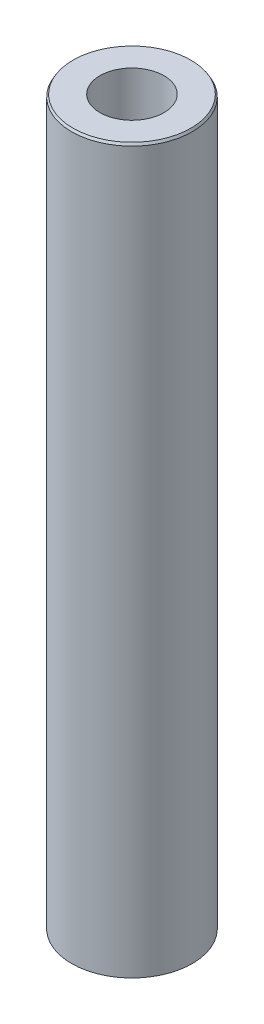
from build123d import *
from OCP.BRepFilletAPI import BRepFilletAPI_MakeChamfer

# Parameters (mm, degrees)
SKETCH1_R           = 50
BOSS_EXTRUDE1_DEPTH = 600
SKETCH2_R           = 26.546600686
CUT_EXTRUDE1_DEPTH  = 605.15229868
CHAMFER1_SIZE       = 1.96995099
CHAMFER1_SIZE2      = 1.137351734


with BuildPart() as part:
    # Sketch1 → Boss-Extrude1 (new body)
    with BuildSketch(Plane(origin=(0, 0, 0), x_dir=(1, 0, 0), z_dir=(0, 1, 0))):
        Circle(SKETCH1_R)
    extrude(amount=BOSS_EXTRUDE1_DEPTH)

    # Sketch2 → Cut-Extrude1 (cut, through all)
    with BuildSketch(Plane(origin=(0, 0, 0), x_dir=(1, 0, 0), z_dir=(0, 1, 0))):
        Circle(SKETCH2_R)
    extrude(amount=CUT_EXTRUDE1_DEPTH, mode=Mode.SUBTRACT)

    # Chamfer1: one chamfer whose edges measure the first distance from different faces: ONE call of the kernel's chamfer builder (chamfer() names one face for all edges)
    chamfer1_edges_1 = [part.edges().sort_by_distance(p)[0] for p in [
        (-50, 600, 0),
    ]]
    chamfer1_side_1 = [part.faces().sort_by_distance(p)[0] for p in [
        (-50, 300, 0),
    ]]
    chamfer1_edges_2 = [part.edges().sort_by_distance(p)[0] for p in [
        (-50, 0, 0),
    ]]
    chamfer1_side_2 = [part.faces().sort_by_distance(p)[0] for p in [
        (-48.585786438, 0, 0),
    ]]
    chamfer1 = BRepFilletAPI_MakeChamfer(part.part.solid().wrapped)
    for e in chamfer1_edges_1:
        chamfer1.Add(CHAMFER1_SIZE, CHAMFER1_SIZE2, e.wrapped, chamfer1_side_1[0].wrapped)  # the first distance lies on this face
    for e in chamfer1_edges_2:
        chamfer1.Add(CHAMFER1_SIZE, CHAMFER1_SIZE2, e.wrapped, chamfer1_side_2[0].wrapped)  # the first distance lies on this face
    add(Compound.cast(chamfer1.Shape()), mode=Mode.REPLACE)


solid = part.part
